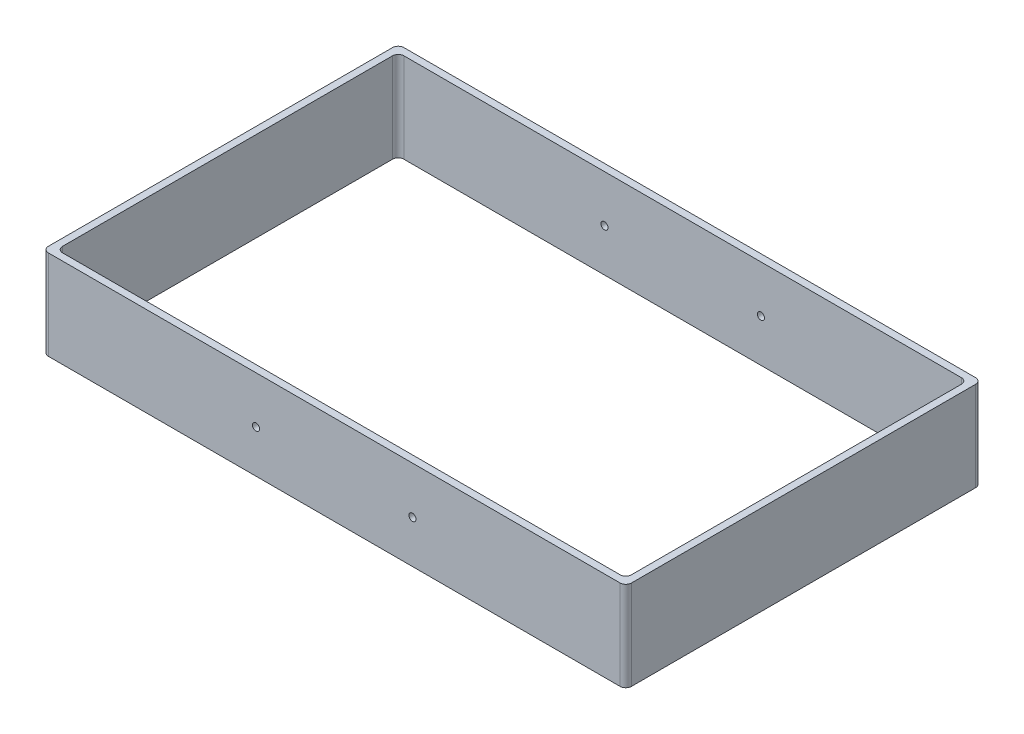
from build123d import *

# Parameters (mm, degrees)
SKETCH4_W           = 260.35
SKETCH4_H           = 158.75
SKETCH4_W_2         = 254
SKETCH4_H_2         = 152.4
BOSS_EXTRUDE1_DEPTH = 38.1
SKETCH5_R           = 1.5875
CUT_EXTRUDE1_DEPTH  = 305.618044648
SKETCH5_4_R         = 1.5875
CUT_EXTRUDE2_DEPTH  = 305.618044648
SKETCH8_W           = 260.35
SKETCH8_H           = 158.75
SKETCH8_W_2         = 254
SKETCH8_H_2         = 152.4
BOSS_EXTRUDE2_DEPTH = 1.905
FILLET1_R           = 2.54
FILLET2_R           = 2.54


with BuildPart() as part:
    # Sketch4 → Boss-Extrude1 (new body)
    with BuildSketch(Plane(origin=(0, 0, 0), x_dir=(1, 0, 0), z_dir=(0, 1, 0))):
        with Locations((127, 76.2)):
            Rectangle(SKETCH4_W, SKETCH4_H)
        with Locations((127, 76.2)):
            Rectangle(SKETCH4_W_2, SKETCH4_H_2, mode=Mode.SUBTRACT)
    extrude(amount=BOSS_EXTRUDE1_DEPTH)

    # Sketch5 → Cut-Extrude1 (cut, through all)
    with BuildSketch(Plane.XY.offset(3.175)):
        with Locations((92.075, 19.05)):
            Circle(SKETCH5_R)
    extrude(amount=-CUT_EXTRUDE1_DEPTH, mode=Mode.SUBTRACT)

    # Sketch5<4> → Cut-Extrude2 (cut, through all)
    with BuildSketch(Plane.XY.offset(3.175)):
        with Locations((161.925, 19.05)):
            Circle(SKETCH5_4_R)
    extrude(amount=-CUT_EXTRUDE2_DEPTH, mode=Mode.SUBTRACT)

    # Sketch8 → Boss-Extrude2 (add)
    with BuildSketch(Plane(origin=(0, 38.1, 0), x_dir=(1, 0, 0), z_dir=(0, 1, 0))):
        with Locations((127, 76.2)):
            Rectangle(SKETCH8_W, SKETCH8_H)
        with Locations((127, 76.2)):
            Rectangle(SKETCH8_W_2, SKETCH8_H_2, mode=Mode.SUBTRACT)
    extrude(amount=BOSS_EXTRUDE2_DEPTH)

    # Fillet1
    fillet1_edges = [part.edges().sort_by_distance(p)[0] for p in [
        (254, 20.0025, 0),
        (0, 20.0025, 0),
        (254, 20.0025, -152.4),
        (0, 20.0025, -152.4),
    ]]
    fillet(fillet1_edges, radius=FILLET1_R)

    # Fillet2
    fillet2_edges = [part.edges().sort_by_distance(p)[0] for p in [
        (-3.175, 20.0025, 3.175),
        (-3.175, 20.0025, -155.575),
        (257.175, 20.0025, -155.575),
        (257.175, 20.0025, 3.175),
    ]]
    fillet(fillet2_edges, radius=FILLET2_R)


solid = part.part
